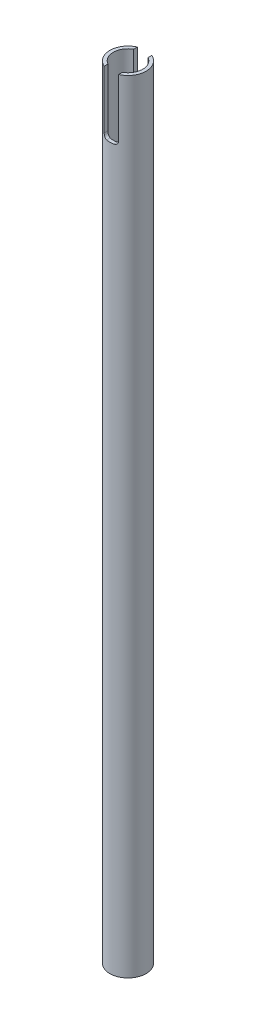
from build123d import *
from OCP.BRepAlgoAPI import BRepAlgoAPI_Cut
from OCP.TopTools import TopTools_ListOfShape

# Parameters (mm, degrees)
BOSS_EXTRUDE1_START     = -164.670652
SKETCH1_R               = 7.9375
SKETCH1_R_2             = 6.4643
BOSS_EXTRUDE1_DEPTH     = 343.055109872
CUT_EXTRUDE1_DEPTH      = 179.737300592
CUT_EXTRUDE1_DEPTH_BACK = 179.737300592


with BuildPart() as part:
    # Sketch1 → Boss-Extrude1 (new body)
    with BuildSketch(Plane(origin=(0, 0, 0), x_dir=(1, 0, 0), z_dir=(0, 1, 0)).offset(BOSS_EXTRUDE1_START)):
        with Locations(Location((0, 0, 0), (0, 0, 270))):
            Circle(SKETCH1_R)
        with Locations(Location((0, 0, 0), (0, 0, 270))):
            Circle(SKETCH1_R_2, mode=Mode.SUBTRACT)
    extrude(amount=BOSS_EXTRUDE1_DEPTH)


with BuildPart() as cut_extrude1_tool:
    # Sketch2 → Cut-Extrude1 (new, two sides: drawn at the far end of the back side and taken through both)
    with BuildSketch(Plane.XY.offset(-CUT_EXTRUDE1_DEPTH_BACK)):
        with BuildLine():
            Line((-3.175, 178.384457539), (3.175, 178.384457539))
            Line((3.175, 178.384457539), (3.175, 152.984457539))
            ThreePointArc((3.175, 152.984457539), (2.710032015, 151.861925524), (1.5875, 151.396957539))
            Line((1.5875, 151.396957539), (-1.5875, 151.396957539))
            ThreePointArc((-1.5875, 151.396957539), (-2.710032015, 151.861925524), (-3.175, 152.984457539))
            Line((-3.175, 152.984457539), (-3.175, 178.384457539))
        make_face()
    extrude(amount=CUT_EXTRUDE1_DEPTH + CUT_EXTRUDE1_DEPTH_BACK)


with BuildPart() as part_1:
    add(part.part)

    # Cut-Extrude1: cut by cut_extrude1_tool, with a tolerance
    cut_extrude1_stock = TopTools_ListOfShape()
    cut_extrude1_stock.Append(part_1.part.wrapped)
    cut_extrude1_tools = TopTools_ListOfShape()
    cut_extrude1_tools.Append(cut_extrude1_tool.part.wrapped)
    cut_extrude1_cut = BRepAlgoAPI_Cut()
    cut_extrude1_cut.SetArguments(cut_extrude1_stock)
    cut_extrude1_cut.SetTools(cut_extrude1_tools)
    cut_extrude1_cut.SetFuzzyValue(0.00001)
    cut_extrude1_cut.Build()
    add(Compound.cast(cut_extrude1_cut.Shape()).solids(), mode=Mode.REPLACE)


solid = part_1.part
